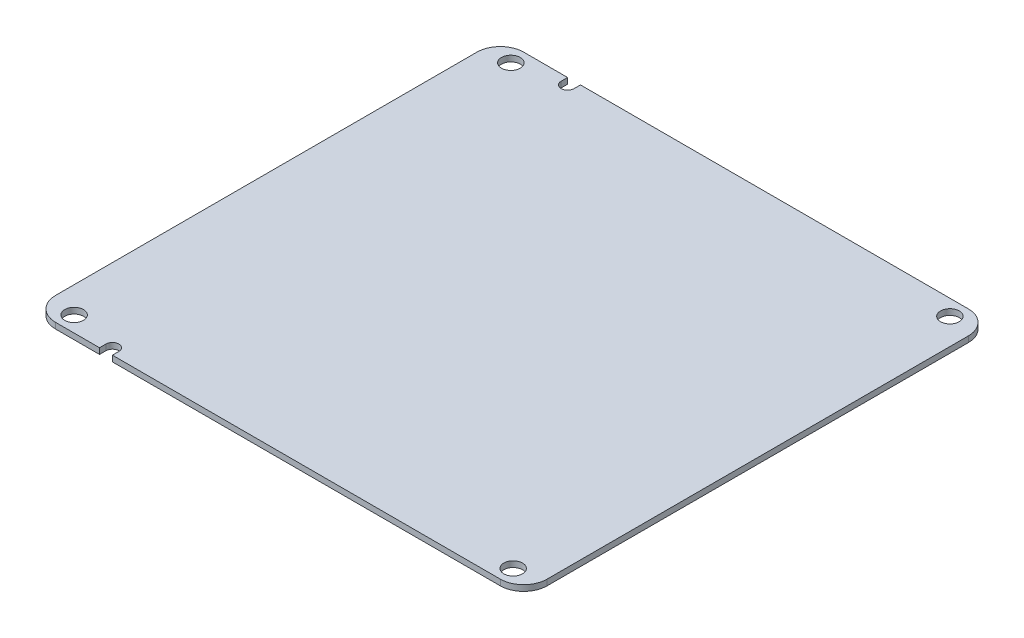
from build123d import *

# Parameters (mm, degrees)
SKETCH1_W                  = 105
SKETCH1_H                  = 100
MAIN_PCB_DEPTH             = 1.25
MAIN_PCB_ROUNDED_CORNERS_R = 5
MAIN_PCB_HOLES_REACH       = 74.511
SKETCH2_R                  = 2


with BuildPart() as part:
    # Sketch1 → Main PCB (new body)
    with BuildSketch(Plane(origin=(0, 0, 0), x_dir=(1, 0, 0), z_dir=(0, 1, 0))):
        Rectangle(SKETCH1_W, SKETCH1_H)
    extrude(amount=MAIN_PCB_DEPTH)

    # Main PCB rounded corners
    main_pcb_rounded_corners_edges = [part.edges().sort_by_distance(p)[0] for p in [
        (-52.5, 0.625, -50),
        (52.5, 0.625, -50),
        (52.5, 0.625, 50),
        (-52.5, 0.625, 50),
    ]]
    fillet(main_pcb_rounded_corners_edges, radius=MAIN_PCB_ROUNDED_CORNERS_R)

    # Sketch2 → Main PCB holes (cut, up to next)
    with BuildSketch(Plane(origin=(0, 1.25, 0), x_dir=(1, 0, 0), z_dir=(0, 1, 0)), mode=Mode.PRIVATE) as main_pcb_holes_sk1:
        with BuildLine():
            Line((-38.125, -50), (-35.375, -50))
            Line((-35.375, -50), (-35.375, -48.625))
            ThreePointArc((-35.375, -48.625), (-36.75, -47.25), (-38.125, -48.625))
            Line((-38.125, -48.625), (-38.125, -50))
        make_face()
    main_pcb_holes_tool1 = extrude(main_pcb_holes_sk1.sketch, amount=-MAIN_PCB_HOLES_REACH, mode=Mode.PRIVATE) & part.part
    # Sketch2 → Main PCB holes (cut, up to next)
    with BuildSketch(Plane(origin=(0, 1.25, 0), x_dir=(1, 0, 0), z_dir=(0, 1, 0)), mode=Mode.PRIVATE) as main_pcb_holes_sk2:
        with BuildLine():
            Line((-35.375, 50), (-38.125, 50))
            Line((-38.125, 50), (-38.125, 48.625))
            ThreePointArc((-38.125, 48.625), (-36.75, 47.25), (-35.375, 48.625))
            Line((-35.375, 48.625), (-35.375, 50))
        make_face()
    main_pcb_holes_tool2 = extrude(main_pcb_holes_sk2.sketch, amount=-MAIN_PCB_HOLES_REACH, mode=Mode.PRIVATE) & part.part
    # Sketch2 → Main PCB holes (cut, up to next)
    with BuildSketch(Plane(origin=(0, 1.25, 0), x_dir=(1, 0, 0), z_dir=(0, 1, 0)), mode=Mode.PRIVATE) as main_pcb_holes_sk3:
        with Locations((-46.9, -46.65)):
            Circle(SKETCH2_R)
    main_pcb_holes_tool3 = extrude(main_pcb_holes_sk3.sketch, amount=-MAIN_PCB_HOLES_REACH, mode=Mode.PRIVATE) & part.part
    # Sketch2 → Main PCB holes (cut, up to next)
    with BuildSketch(Plane(origin=(0, 1.25, 0), x_dir=(1, 0, 0), z_dir=(0, 1, 0)), mode=Mode.PRIVATE) as main_pcb_holes_sk4:
        with Locations((46.9, -46.65)):
            Circle(SKETCH2_R)
    main_pcb_holes_tool4 = extrude(main_pcb_holes_sk4.sketch, amount=-MAIN_PCB_HOLES_REACH, mode=Mode.PRIVATE) & part.part
    # Sketch2 → Main PCB holes (cut, up to next)
    with BuildSketch(Plane(origin=(0, 1.25, 0), x_dir=(1, 0, 0), z_dir=(0, 1, 0)), mode=Mode.PRIVATE) as main_pcb_holes_sk5:
        with Locations((46.9, 46.65)):
            Circle(SKETCH2_R)
    main_pcb_holes_tool5 = extrude(main_pcb_holes_sk5.sketch, amount=-MAIN_PCB_HOLES_REACH, mode=Mode.PRIVATE) & part.part
    # Sketch2 → Main PCB holes (cut, up to next)
    with BuildSketch(Plane(origin=(0, 1.25, 0), x_dir=(1, 0, 0), z_dir=(0, 1, 0)), mode=Mode.PRIVATE) as main_pcb_holes_sk6:
        with Locations((-46.9, 46.65)):
            Circle(SKETCH2_R)
    main_pcb_holes_tool6 = extrude(main_pcb_holes_sk6.sketch, amount=-MAIN_PCB_HOLES_REACH, mode=Mode.PRIVATE) & part.part
    add(main_pcb_holes_tool1.solids().sort_by_distance((-36.75, 1.25, 48.753356))[0], mode=Mode.SUBTRACT)
    add(main_pcb_holes_tool2.solids().sort_by_distance((-36.75, 1.25, -48.753356))[0], mode=Mode.SUBTRACT)
    add(main_pcb_holes_tool3.solids().sort_by_distance((-46.9, 1.25, 46.65))[0], mode=Mode.SUBTRACT)
    add(main_pcb_holes_tool4.solids().sort_by_distance((46.9, 1.25, 46.65))[0], mode=Mode.SUBTRACT)
    add(main_pcb_holes_tool5.solids().sort_by_distance((46.9, 1.25, -46.65))[0], mode=Mode.SUBTRACT)
    add(main_pcb_holes_tool6.solids().sort_by_distance((-46.9, 1.25, -46.65))[0], mode=Mode.SUBTRACT)


solid = part.part
